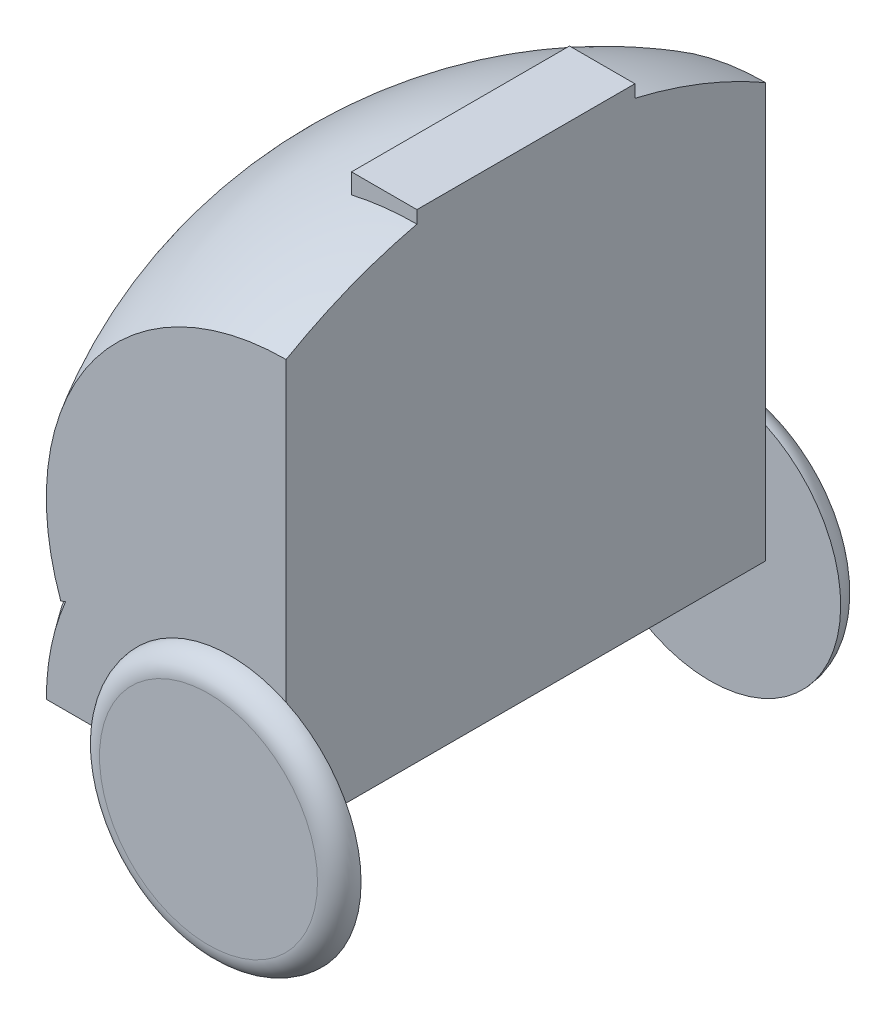
from build123d import *

# Parameters (mm, degrees)
OBR_T1_ANGLE                = 90
OBR_T2_ANGLE                = 110
DODANIE_WYCI_GNI_CIE1_DEPTH = 15
SZKIC5_R                    = 30
DODANIE_WYCI_GNI_CIE2_DEPTH = 5
ZAOKR_GLENIE1_R             = 5
DODANIE_WYCI_GNI_CIE3_START = 5
SZKIC6_R                    = 30
DODANIE_WYCI_GNI_CIE3_DEPTH = 5
ZAOKR_GLENIE2_R             = 5


with BuildPart() as part:
    # Szkic1 → Obrót1 (revolve)
    with BuildSketch(Plane(origin=(0, 0, 0), x_dir=(1, 0, 0), z_dir=(0, 1, 0))):
        with BuildLine():
            Line((-20, -55), (-20, 55))
            Line((-20, 55), (-75, 55))
            ThreePointArc((-75, 55), (-93.005376189, 0), (-75, -55))
            Line((-75, -55), (-20, -55))
        make_face()
    revolve(axis=Axis((-20, 0, 55), (0, 0, -1)), revolution_arc=OBR_T1_ANGLE)

    # Szkic2 → Obrót2 (revolve)
    with BuildSketch(Plane(origin=(-20, 0, 0), x_dir=(0, 0, -1), z_dir=(1, 0, 0))):
        with BuildLine():
            Line((-55, 55), (-55, 40))
            Line((-55, 40), (55, 40))
            Line((55, 40), (55, 55))
            Line((55, 55), (55, 95))
            ThreePointArc((55, 95), (0, 109.772492001), (-55, 95))
            Line((-55, 95), (-55, 55))
        make_face()
    revolve(axis=Axis((-20, 40, 55), (0, 0, 1)), revolution_arc=OBR_T2_ANGLE)

    # Szkic3 → Dodanie-wyciągnięcie1 (add)
    with BuildSketch(Plane(origin=(-20, 0, 0), x_dir=(0, 0, -1), z_dir=(1, 0, 0))):
        Polygon((0, 109.772492001), (-25, 109.772492001), (-25, 99.772492001), (25, 99.772492001), (25, 109.772492001), align=None)
    extrude(amount=-DODANIE_WYCI_GNI_CIE1_DEPTH)

    # Szkic5 → Dodanie-wyciągnięcie2 (add)
    with BuildSketch(Plane.XY.offset(55)):
        with Locations(Location((-32.802857824, -0.227507999, 0), (0, 0, 179.565487562))):
            Circle(SZKIC5_R)
    extrude(amount=DODANIE_WYCI_GNI_CIE2_DEPTH)

    # Zaokrąglenie1
    zaokr_glenie1_edges = [part.edges().sort_by_distance(p)[0] for p in [
        (-2.803720502, -0.455015999, 60),
    ]]
    fillet(zaokr_glenie1_edges, radius=ZAOKR_GLENIE1_R - 0.0001)  # a hair under: the kernel refuses the full size

    # Szkic6 → Dodanie-wyciągnięcie3 (add)
    with BuildSketch(Plane(origin=(0, 0, -55), x_dir=(-1, 0, 0), z_dir=(0, 0, -1)).offset(DODANIE_WYCI_GNI_CIE3_START)):
        with Locations(Location((32.802857824, -0.227507999, 0), (0, 0, 115.262238739))):
            Circle(SZKIC6_R)
    extrude(amount=-DODANIE_WYCI_GNI_CIE3_DEPTH)

    # Zaokrąglenie2
    zaokr_glenie2_edges = [part.edges().sort_by_distance(p)[0] for p in [
        (-45.605715649, -27.358428211, -60),
    ]]
    fillet(zaokr_glenie2_edges, radius=ZAOKR_GLENIE2_R - 0.0001)  # a hair under: the kernel refuses the full size


solid = part.part
